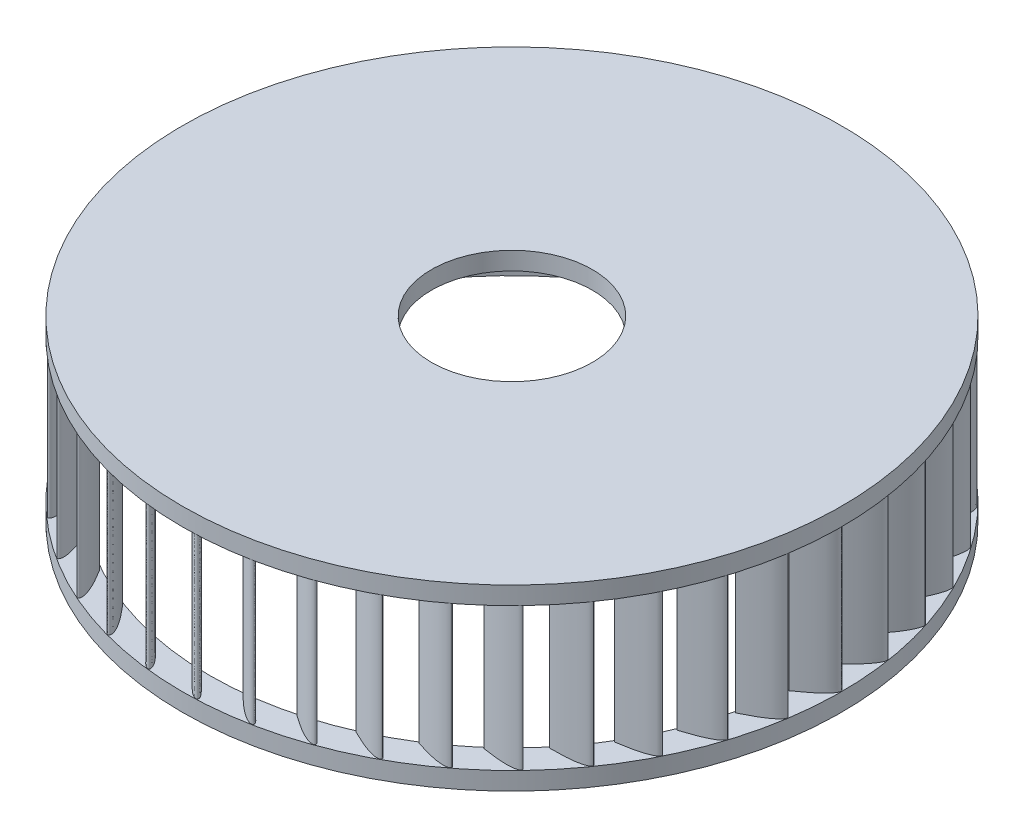
from build123d import *

# Parameters (mm, degrees)
CROQUIS1_R              = 3685
CROQUIS1_R_2            = 3375
SALIENTE_EXTRUIR1_DEPTH = 200
SALIENTE_EXTRUIR2_DEPTH = 1596
MATRIZC1_COUNT          = 41
CROQUIS5_R              = 3685
CROQUIS5_R_2            = 900
SALIENTE_EXTRUIR3_DEPTH = 200


with BuildPart() as part:
    # Croquis1 → Saliente-Extruir1 (new body)
    with BuildSketch(Plane(origin=(0, 0, 0), x_dir=(1, 0, 0), z_dir=(0, 1, 0))):
        Circle(CROQUIS1_R)
        Circle(CROQUIS1_R_2, mode=Mode.SUBTRACT)
    extrude(amount=SALIENTE_EXTRUIR1_DEPTH)

    # Croquis2 → Saliente-Extruir2 (add)
    with BuildSketch(Plane(origin=(0, 200, 0), x_dir=(1, 0, 0), z_dir=(0, 1, 0))):
        with BuildLine():
            Line((-155.550812201, -3389.043448049), (-154.494246783, -3387.886199033))
            add(Edge.make_bspline(
                [(-155.550812201, -3389.043448049), (-153.426323702, -3391.928965632), (-150.46473433, -3395.928156353), (-145.773463035, -3402.207856049), (-141.978910236, -3407.251409945), (-137.764966155, -3412.809276731), (-133.564617895, -3418.315366462), (-128.755644581, -3424.574959862), (-123.033427664, -3431.961349557), (-116.868079925, -3439.847080991), (-110.927790967, -3447.372252972), (-105.729397698, -3453.90377816), (-100.376491878, -3460.586147452), (-94.132244573, -3468.320172945), (-87.275099718, -3476.726683979), (-80.346807614, -3485.138648819), (-74.090713704, -3492.663197439), (-67.90415487, -3500.034523513), (-62.585968691, -3506.316716346), (-57.519798613, -3512.252715421), (-52.833735447, -3517.702694179), (-47.975945992, -3523.308338437), (-42.723554766, -3529.31842596), (-37.078490428, -3535.714129458), (-31.618763733, -3541.831515109), (-26.179314034, -3547.864390265), (-20.830188832, -3553.733609774), (-15.21928121, -3559.812643661), (-9.432021087, -3566.004025547), (-3.971573392, -3571.763428439), (1.267270247, -3577.210240193), (5.752209925, -3581.814716077), (10.656609329, -3586.786565903), (15.864627093, -3591.986957709), (21.527337714, -3597.538396239), (27.221681286, -3603.016393114), (33.507012232, -3608.937399819), (39.463352216, -3614.403903724), (45.352198199, -3619.673844541), (50.477857368, -3624.154838494), (56.508033983, -3629.287948843), (62.322267902, -3634.081493842), (68.227781735, -3638.776719231), (73.493407649, -3642.828432477), (79.974321429, -3647.635384176), (86.797595116, -3652.429910576), (93.407815987, -3656.76869767), (98.674286519, -3660.033936848), (103.666438885, -3662.959641505), (108.841450653, -3665.783697068), (114.01803958, -3668.371035103), (118.912223554, -3670.579275745), (123.636387448, -3672.461595999), (128.140826805, -3673.990544481), (132.072230717, -3675.061960003), (135.386263459, -3675.747936937), (138.291819847, -3676.174521496), (141.016524527, -3676.37537554), (143.700047422, -3676.348149534), (146.142118552, -3676.09311638), (148.548534582, -3675.548703694), (150.570526288, -3674.791831757), (152.828785114, -3673.571187764), (154.785666548, -3671.944745385), (156.389616292, -3669.861288475), (157.430563659, -3667.930914643), (158.100994557, -3666.029876986), (158.588814796, -3663.796451564), (158.818823184, -3661.255138207), (158.705960286, -3658.29843092), (158.19801077, -3654.632017691), (157.331165511, -3651.140840247), (156.267028257, -3647.889115158), (155.389450651, -3645.536015499), (154.441973222, -3643.23422218), (153.422939994, -3640.961869302), (152.374412401, -3638.787699903), (151.388841086, -3636.856010628), (150.391497757, -3634.98739826), (149.399793985, -3633.205943205), (148.311651041, -3631.323236928), (147.241548479, -3629.536304957), (146.078442077, -3627.657057226), (144.929454883, -3625.855705823), (143.729561282, -3624.028201283), (142.619445069, -3622.380845967), (141.500684572, -3620.756583408), (140.399626468, -3619.1905502), (139.172614182, -3617.481210633), (138.01702981, -3615.904195789), (136.812775138, -3614.289888997), (135.654771025, -3612.763244936), (134.41374243, -3611.155469965), (133.2008091, -3609.60929589), (132.033667822, -3608.144129612), (130.901897452, -3606.742684966), (129.671784054, -3605.238516712), (128.436414128, -3603.749486481), (127.217646494, -3602.299943931), (126.141842765, -3601.034052817), (125.039609668, -3599.75045977), (123.700657839, -3598.207532781), (122.21508031, -3596.518329638), (120.454120668, -3594.544328), (118.414141576, -3592.290421936), (115.887502381, -3589.548548679), (113.050060906, -3586.531380111), (110.225747329, -3583.587941626), (107.661377913, -3580.962051692), (105.157069328, -3578.434551501), (102.486087402, -3575.776903291), (99.579148495, -3572.930067971), (96.401375256, -3569.865939707), (93.345344582, -3566.965697988), (90.269256287, -3564.088618802), (87.417308211, -3561.454323008), (84.576703528, -3558.86259219), (81.522304634, -3556.107034438), (78.5263189, -3553.436977827), (75.131764439, -3550.446768976), (71.799649344, -3547.545524548), (67.92414629, -3544.212123802), (64.101930769, -3540.965401877), (59.871607264, -3537.416071019), (56.078090879, -3534.271900721), (52.415435625, -3531.268149881), (49.138064789, -3528.602889841), (45.860559345, -3525.960443591), (42.592731953, -3523.346550647), (39.385644141, -3520.800298325), (35.966615332, -3518.106225691), (31.992616836, -3514.998947387), (27.839484499, -3511.781339587), (23.71735768, -3508.616157604), (19.962837018, -3505.753928592), (16.183208223, -3502.892445711), (12.190614477, -3499.890881807), (8.089902435, -3496.82986818), (3.871521825, -3493.703290914), (-0.335783943, -3490.606448057), (-5.108629465, -3487.11664479), (-9.510805141, -3483.922409191), (-14.720485718, -3480.16684624), (-19.648024324, -3476.639062148), (-25.856203422, -3472.229621596), (-32.242093403, -3467.730056834), (-38.769232234, -3463.172203984), (-44.310495236, -3459.332397072), (-48.818927609, -3456.225930708), (-52.97142492, -3453.378350533), (-57.072023085, -3450.580220508), (-61.696060018, -3447.440000341), (-66.457430008, -3444.224070099), (-71.496634926, -3440.840502398), (-76.38015363, -3437.578849182), (-80.707153686, -3434.704827011), (-84.830746743, -3431.978702024), (-88.494049077, -3429.566787378), (-92.205552019, -3427.134072655), (-95.755643581, -3424.816531969), (-99.295032383, -3422.515115234), (-102.880170085, -3420.193832973), (-106.885424844, -3417.611287181), (-111.036058662, -3414.947892636), (-115.361131746, -3412.187316548), (-119.329299233, -3409.666882413), (-122.846153991, -3407.44368439), (-126.200119708, -3405.332215288), (-129.403473556, -3403.323545434), (-132.868112529, -3401.16051811), (-136.111857891, -3399.144582211), (-139.322546097, -3397.157629457), (-142.2591786, -3395.347644189), (-145.026198972, -3393.649175795), (-149.047957822, -3391.188773573), (-152.147951397, -3389.304373897), (-154.494246783, -3387.886199033)],
                knots=[0, 0, 0, 0, 0.01237431, 0.017185286, 0.027069406, 0.034170499, 0.041271714, 0.050985088, 0.061429965, 0.073538536, 0.085552603, 0.094538214, 0.102366242, 0.115120344, 0.128865025, 0.139830011, 0.152754511, 0.162658158, 0.17306318, 0.181179095, 0.189608205, 0.19788458, 0.206794935, 0.217172204, 0.227343943, 0.235110582, 0.245223916, 0.254767328, 0.263679011, 0.274491107, 0.282174552, 0.289777172, 0.296688365, 0.306291857, 0.315193164, 0.324073245, 0.333578341, 0.345012591, 0.351991233, 0.360868577, 0.368523091, 0.379338221, 0.386889531, 0.394576371, 0.402281408, 0.414753655, 0.423368892, 0.429583628, 0.436150933, 0.443348796, 0.449938603, 0.45613161, 0.461885521, 0.467493736, 0.472550063, 0.475946515, 0.479175191, 0.482685581, 0.485369227, 0.488434187, 0.491146069, 0.493869424, 0.495859759, 0.499995309, 0.502531551, 0.504902811, 0.507539235, 0.509463799, 0.512786878, 0.516318663, 0.51965975, 0.525554896, 0.52870917, 0.531473345, 0.53422555, 0.53730394, 0.540072136, 0.542560477, 0.544792376, 0.547386452, 0.549601108, 0.55230166, 0.554578951, 0.557233104, 0.559679869, 0.562128578, 0.564093036, 0.566490785, 0.568739473, 0.571359325, 0.573242297, 0.575694542, 0.577976406, 0.580256146, 0.58248092, 0.584445264, 0.586476934, 0.589191194, 0.591126692, 0.593016993, 0.594928177, 0.596969439, 0.600071846, 0.602696537, 0.606104634, 0.610570005, 0.615572271, 0.620407514, 0.624657102, 0.628247152, 0.63269477, 0.637669029, 0.642297934, 0.647939308, 0.652218473, 0.656843051, 0.661346648, 0.665497563, 0.671049116, 0.675205348, 0.68111974, 0.686306594, 0.692858438, 0.698438391, 0.705376341, 0.709873531, 0.714796416, 0.719964422, 0.724412395, 0.729247495, 0.734105879, 0.739444587, 0.746668311, 0.752248852, 0.757392248, 0.762972019, 0.768620042, 0.774641892, 0.780643574, 0.786752778, 0.792682857, 0.801061967, 0.805535497, 0.814861226, 0.82199001, 0.831832118, 0.841838552, 0.849482274, 0.855113508, 0.860745926, 0.866870262, 0.872257148, 0.880048624, 0.886712235, 0.893218335, 0.900328821, 0.904650813, 0.910289255, 0.915475369, 0.919975923, 0.924930161, 0.930054908, 0.934725337, 0.941387808, 0.947085826, 0.952444559, 0.957621953, 0.961454054, 0.966131167, 0.970679286, 0.975559056, 0.979320111, 0.983718467, 0.987471877, 0.990532258, 1, 1, 1, 1], degree=3))
        make_face()
    saliente_extruir2 = extrude(amount=SALIENTE_EXTRUIR2_DEPTH)

    # MatrizC1: Saliente-Extruir2 ×41 about axis
    matrizc1_axis = Axis((0, 0, 0), (0, 1, 0))
    for i in range(1, MATRIZC1_COUNT):
        add(saliente_extruir2.rotate(matrizc1_axis, i * 360 / MATRIZC1_COUNT))

    # Croquis5 → Saliente-Extruir3 (add)
    with BuildSketch(Plane(origin=(0, 1796, 0), x_dir=(1, 0, 0), z_dir=(0, 1, 0))):
        Circle(CROQUIS5_R)
        Circle(CROQUIS5_R_2, mode=Mode.SUBTRACT)
    extrude(amount=SALIENTE_EXTRUIR3_DEPTH)


solid = part.part
